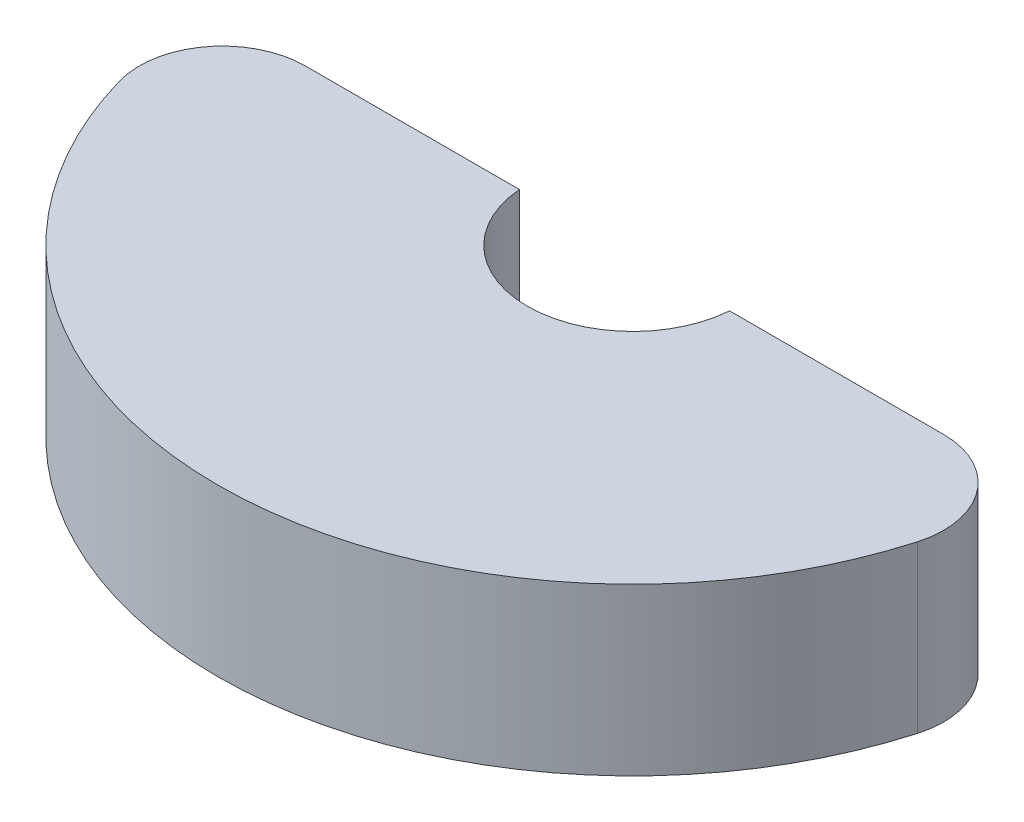
from build123d import *

# Parameters (mm, degrees)
BOSS_EXTRUDE1_DEPTH = 10
FILLET1_R           = 5


with BuildPart() as part:
    # Sketch1 → Boss-Extrude1 (new body)
    with BuildSketch(Plane(origin=(0, 0, 0), x_dir=(1, 0, 0), z_dir=(0, 1, 0))):
        with BuildLine():
            Line((-6.330284354, -50.5), (-24.9949995, -50.5))
            ThreePointArc((-24.9949995, -50.5), (0, -75), (24.9949995, -50.5))
            Line((24.9949995, -50.5), (6.330284354, -50.5))
            ThreePointArc((6.330284354, -50.5), (0, -56.35), (-6.330284354, -50.5))
        make_face()
    extrude(amount=BOSS_EXTRUDE1_DEPTH)

    # Fillet1
    fillet1_edges = [part.edges().sort_by_distance(p)[0] for p in [
        (-24.9949995, 5, 50.5),
        (24.9949995, 5, 50.5),
    ]]
    fillet(fillet1_edges, radius=FILLET1_R)


solid = part.part
